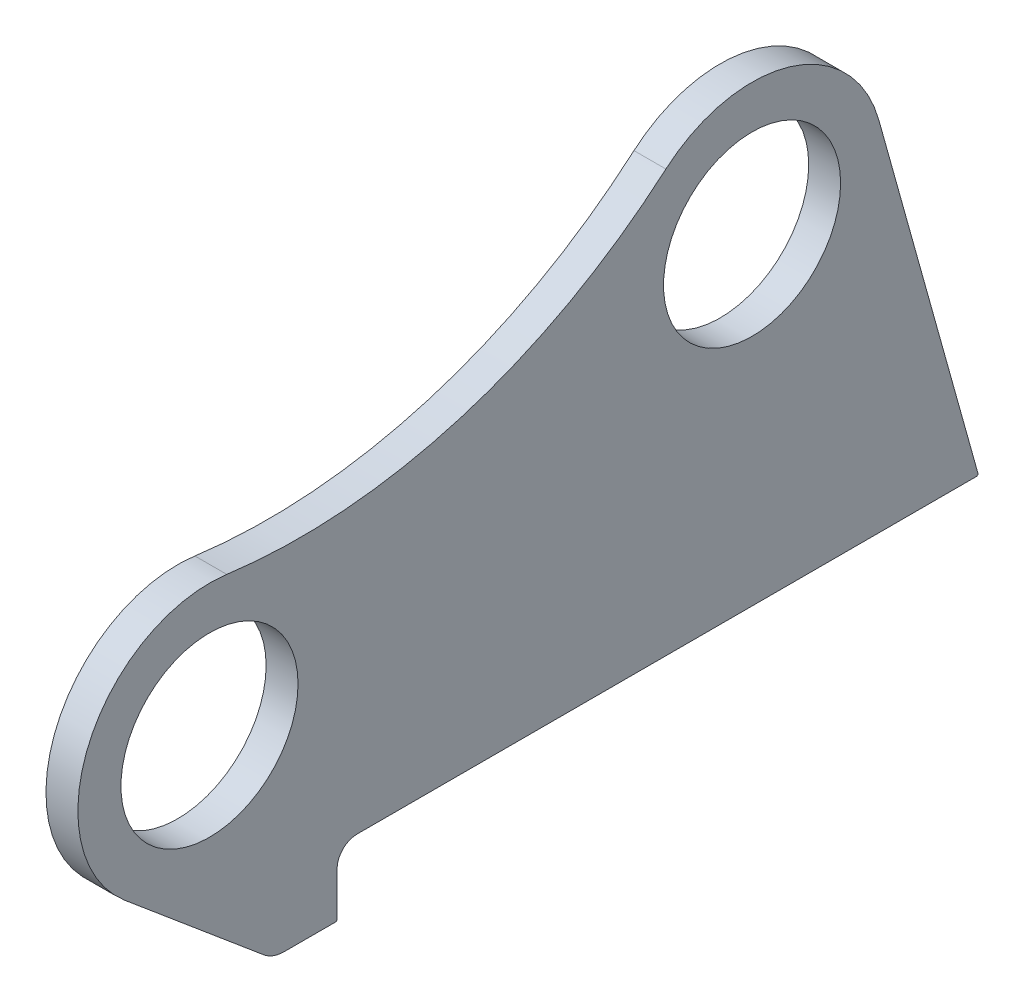
from build123d import *

# Parameters (mm, degrees)
SKETCH1_R          = 55.5
BASE_FLANGE1_DEPTH = 20
FILLET_1_0_R       = 1


# Sheet-metal steps are written as plain solids
with BuildPart() as part:
    # Sketch1 → Base-Flange1 (new body)
    with BuildSketch(Plane(origin=(0, 0, 0), x_dir=(0, 0, -1), z_dir=(1, 0, 0))):
        with BuildLine():
            Line((0, -41), (0, -12.5))
            ThreePointArc((0, -12.5), (3.661165235, -3.661165235), (12.5, 0))
            Line((12.5, 0), (402, 0))
            Line((402, 0), (339.540553103, 224.02120437))
            ThreePointArc((339.540553103, 224.02120437), (283.858577294, 280.860778622), (206.049724664, 264.217399056))
            ThreePointArc((206.049724664, 264.217399056), (77.296032092, 193.463443053), (-69.152665136, 181.783771779))
            ThreePointArc((-69.152665136, 181.783771779), (-155.489722436, 133.27990094), (-133.058215758, 36.825038658))
            Line((-133.058215758, 36.825038658), (-45.972209781, -36.315142143))
            ThreePointArc((-45.972209781, -36.315142143), (-39.95421417, -39.792323471), (-33.109612021, -41))
            Line((-33.109612021, -41), (0, -41))
        make_face()
        with Locations((-80, 100)):
            Circle(SKETCH1_R, mode=Mode.SUBTRACT)
        with Locations((260.071524539, 201.864410849)):
            Circle(SKETCH1_R, mode=Mode.SUBTRACT)
    extrude(amount=-BASE_FLANGE1_DEPTH)

    # Fillet-1.0
    fillet_1_0_edges = [part.edges().sort_by_distance(p)[0] for p in [
        (-10, 0, -402),
        (-10, -41, 0),
    ]]
    fillet(fillet_1_0_edges, radius=FILLET_1_0_R)


solid = part.part
